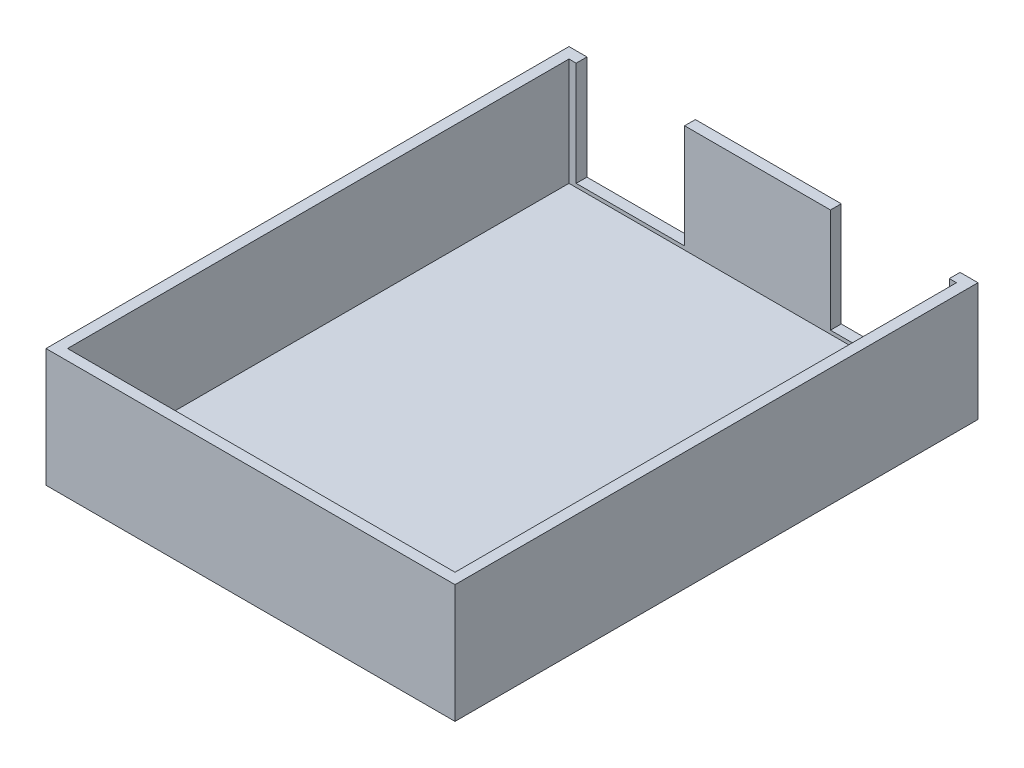
from build123d import *

# Parameters (mm, degrees)
SKETCH1_W           = 53.975
SKETCH1_H           = 69.85
BOSS_EXTRUDE1_DEPTH = 1.5
SKETCH1_4_W         = 56.975
SKETCH1_4_H         = 72.85
SKETCH1_4_W_2       = 53.975
SKETCH1_4_H_2       = 69.85
BOSS_EXTRUDE2_DEPTH = 16.5
CUT_EXTRUDE1_REACH  = 84.822
SKETCH2_W           = 16.55
SKETCH2_H           = 14.5
SKETCH2_W_2         = 15.105


with BuildPart() as part:
    # Sketch1 → Boss-Extrude1 (new body)
    with BuildSketch(Plane(origin=(0, 0, 0), x_dir=(1, 0, 0), z_dir=(0, 1, 0))):
        with Locations((7.2918379, -12.641495434)):
            Rectangle(SKETCH1_W, SKETCH1_H)
    extrude(amount=BOSS_EXTRUDE1_DEPTH)

    # Sketch1<4> → Boss-Extrude2 (add)
    with BuildSketch(Plane(origin=(0, 0, 0), x_dir=(1, 0, 0), z_dir=(0, 1, 0))):
        with Locations((7.2918379, -12.641495434)):
            Rectangle(SKETCH1_4_W, SKETCH1_4_H)
        with Locations((7.2918379, -12.641495434)):
            Rectangle(SKETCH1_4_W_2, SKETCH1_4_H_2, mode=Mode.SUBTRACT)
    extrude(amount=BOSS_EXTRUDE2_DEPTH)

    # Sketch2 → Cut-Extrude1 (cut, up to next)
    with BuildSketch(Plane(origin=(0, 0, -23.783504566), x_dir=(-1, 0, 0), z_dir=(0, 0, -1)), mode=Mode.PRIVATE) as cut_extrude1_sk1:
        with Locations((-25.0043379, 9.25)):
            Rectangle(SKETCH2_W, SKETCH2_H)
    cut_extrude1_tool1 = extrude(cut_extrude1_sk1.sketch, amount=-CUT_EXTRUDE1_REACH, mode=Mode.PRIVATE) & part.part
    # Sketch2 → Cut-Extrude1 (cut, up to next)
    with BuildSketch(Plane(origin=(0, 0, -23.783504566), x_dir=(-1, 0, 0), z_dir=(0, 0, -1)), mode=Mode.PRIVATE) as cut_extrude1_sk2:
        with Locations((11.1431621, 9.25)):
            Rectangle(SKETCH2_W_2, SKETCH2_H)
    cut_extrude1_tool2 = extrude(cut_extrude1_sk2.sketch, amount=-CUT_EXTRUDE1_REACH, mode=Mode.PRIVATE) & part.part
    add(cut_extrude1_tool1.solids().sort_by_distance((25.004338, 9.25, -23.783505))[0], mode=Mode.SUBTRACT)
    add(cut_extrude1_tool2.solids().sort_by_distance((-11.143162, 9.25, -23.783505))[0], mode=Mode.SUBTRACT)


solid = part.part
